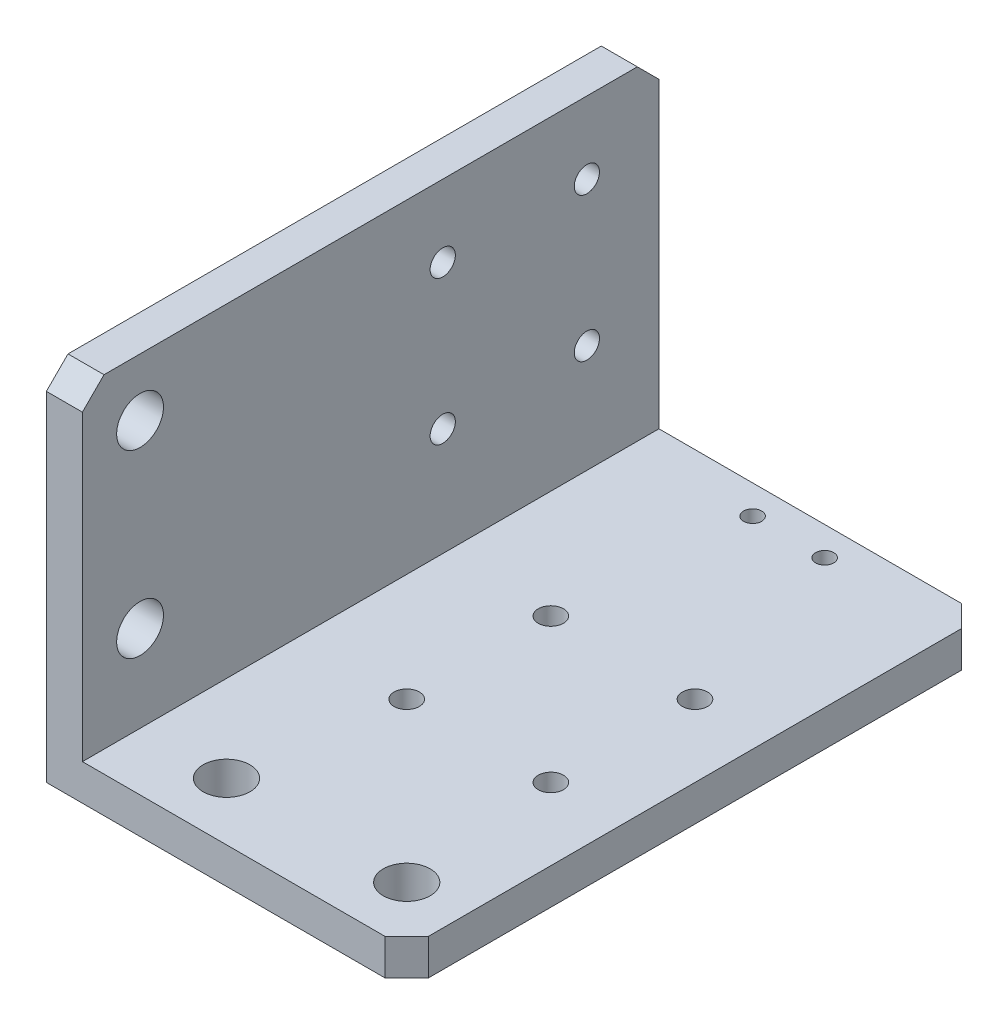
from build123d import *

# Parameters (mm, degrees)
ESTRUSIONE_ESTRUSIONE1_DEPTH = 80
FORO_6_5_6_5_1_D             = 6.5
FORO_6_5_6_5_2_D             = 6.5
FORO_6_5_6_5_2_DEPTH         = 5
FORO_6_5_6_5_2_TIP           = 1.952797012
TAGLIO_ESTRUSIONE3_REACH     = 108.771
SCHIZZO10_R                  = 1.75
TAGLIO_ESTRUSIONE4_REACH     = 108.771
SCHIZZO11_R                  = 1.75
SMUSSO1_SIZE                 = 3
TAGLIO_ESTRUSIONE5_REACH     = 106.523
SCHIZZO12_R                  = 1.25


with BuildPart() as part:
    # Schizzo1 → Estrusione-Estrusione1 (new body)
    with BuildSketch(Plane.XY):
        Polygon((0, 0), (0, 50), (5, 50), (5, 5), (50, 5), (50, 0), align=None)
    extrude(amount=ESTRUSIONE_ESTRUSIONE1_DEPTH)

    # Foro Ø6.5 (6.5)-1 (through all)
    with Locations(Plane(origin=(0, 0, 0), x_dir=(-1, 0, 0), z_dir=(0, -1, 0))):
        with Locations((-17, -72), (-42, -72)):
            Hole(FORO_6_5_6_5_1_D / 2)

    # Foro Ø6.5 (6.5)-2
    with Locations(Plane.ZY):
        with Locations((72, 42), (72, 17)):
            Hole(FORO_6_5_6_5_2_D / 2, depth=FORO_6_5_6_5_2_DEPTH)
            with Locations((0, 0, -(FORO_6_5_6_5_2_DEPTH + FORO_6_5_6_5_2_TIP / 2))):  # 118° drill point
                Cone(0, FORO_6_5_6_5_2_D / 2, FORO_6_5_6_5_2_TIP, mode=Mode.SUBTRACT)

    # Schizzo10 → Taglio-Estrusione3 (cut, up to next)
    with BuildSketch(Plane.ZY, mode=Mode.PRIVATE) as taglio_estrusione3_sk1:
        with Locations((10, 40)):
            Circle(SCHIZZO10_R)
    taglio_estrusione3_tool1 = extrude(taglio_estrusione3_sk1.sketch, amount=-TAGLIO_ESTRUSIONE3_REACH, mode=Mode.PRIVATE) & part.part
    # Schizzo10 → Taglio-Estrusione3 (cut, up to next)
    with BuildSketch(Plane.ZY, mode=Mode.PRIVATE) as taglio_estrusione3_sk2:
        with Locations((30, 40)):
            Circle(SCHIZZO10_R)
    taglio_estrusione3_tool2 = extrude(taglio_estrusione3_sk2.sketch, amount=-TAGLIO_ESTRUSIONE3_REACH, mode=Mode.PRIVATE) & part.part
    # Schizzo10 → Taglio-Estrusione3 (cut, up to next)
    with BuildSketch(Plane.ZY, mode=Mode.PRIVATE) as taglio_estrusione3_sk3:
        with Locations((30, 20)):
            Circle(SCHIZZO10_R)
    taglio_estrusione3_tool3 = extrude(taglio_estrusione3_sk3.sketch, amount=-TAGLIO_ESTRUSIONE3_REACH, mode=Mode.PRIVATE) & part.part
    # Schizzo10 → Taglio-Estrusione3 (cut, up to next)
    with BuildSketch(Plane.ZY, mode=Mode.PRIVATE) as taglio_estrusione3_sk4:
        with Locations((10, 20)):
            Circle(SCHIZZO10_R)
    taglio_estrusione3_tool4 = extrude(taglio_estrusione3_sk4.sketch, amount=-TAGLIO_ESTRUSIONE3_REACH, mode=Mode.PRIVATE) & part.part
    add(taglio_estrusione3_tool1.solids().sort_by_distance((0, 40, 10))[0], mode=Mode.SUBTRACT)
    add(taglio_estrusione3_tool2.solids().sort_by_distance((0, 40, 30))[0], mode=Mode.SUBTRACT)
    add(taglio_estrusione3_tool3.solids().sort_by_distance((0, 20, 30))[0], mode=Mode.SUBTRACT)
    add(taglio_estrusione3_tool4.solids().sort_by_distance((0, 20, 10))[0], mode=Mode.SUBTRACT)

    # Schizzo11 → Taglio-Estrusione4 (cut, up to next)
    with BuildSketch(Plane.XZ, mode=Mode.PRIVATE) as taglio_estrusione4_sk1:
        with Locations((20, 30)):
            Circle(SCHIZZO11_R)
    taglio_estrusione4_tool1 = extrude(taglio_estrusione4_sk1.sketch, amount=-TAGLIO_ESTRUSIONE4_REACH, mode=Mode.PRIVATE) & part.part
    # Schizzo11 → Taglio-Estrusione4 (cut, up to next)
    with BuildSketch(Plane.XZ, mode=Mode.PRIVATE) as taglio_estrusione4_sk2:
        with Locations((20, 50)):
            Circle(SCHIZZO11_R)
    taglio_estrusione4_tool2 = extrude(taglio_estrusione4_sk2.sketch, amount=-TAGLIO_ESTRUSIONE4_REACH, mode=Mode.PRIVATE) & part.part
    # Schizzo11 → Taglio-Estrusione4 (cut, up to next)
    with BuildSketch(Plane.XZ, mode=Mode.PRIVATE) as taglio_estrusione4_sk3:
        with Locations((40, 50)):
            Circle(SCHIZZO11_R)
    taglio_estrusione4_tool3 = extrude(taglio_estrusione4_sk3.sketch, amount=-TAGLIO_ESTRUSIONE4_REACH, mode=Mode.PRIVATE) & part.part
    # Schizzo11 → Taglio-Estrusione4 (cut, up to next)
    with BuildSketch(Plane.XZ, mode=Mode.PRIVATE) as taglio_estrusione4_sk4:
        with Locations((40, 30)):
            Circle(SCHIZZO11_R)
    taglio_estrusione4_tool4 = extrude(taglio_estrusione4_sk4.sketch, amount=-TAGLIO_ESTRUSIONE4_REACH, mode=Mode.PRIVATE) & part.part
    add(taglio_estrusione4_tool1.solids().sort_by_distance((20, 0, 30))[0], mode=Mode.SUBTRACT)
    add(taglio_estrusione4_tool2.solids().sort_by_distance((20, 0, 50))[0], mode=Mode.SUBTRACT)
    add(taglio_estrusione4_tool3.solids().sort_by_distance((40, 0, 50))[0], mode=Mode.SUBTRACT)
    add(taglio_estrusione4_tool4.solids().sort_by_distance((40, 0, 30))[0], mode=Mode.SUBTRACT)

    # Smusso1
    smusso1_edges = [part.edges().sort_by_distance(p)[0] for p in [
        (2.5, 50, 0),
        (50, 2.5, 0),
        (2.5, 50, 80),
        (50, 2.5, 80),
    ]]
    chamfer(smusso1_edges, length=SMUSSO1_SIZE)

    # Schizzo12 → Taglio-Estrusione5 (cut, up to next)
    with BuildSketch(Plane(origin=(0, 5, 0), x_dir=(1, 0, 0), z_dir=(0, 1, 0)), mode=Mode.PRIVATE) as taglio_estrusione5_sk1:
        with Locations((32, -4)):
            Circle(SCHIZZO12_R)
    taglio_estrusione5_tool1 = extrude(taglio_estrusione5_sk1.sketch, amount=-TAGLIO_ESTRUSIONE5_REACH, mode=Mode.PRIVATE) & part.part
    # Schizzo12 → Taglio-Estrusione5 (cut, up to next)
    with BuildSketch(Plane(origin=(0, 5, 0), x_dir=(1, 0, 0), z_dir=(0, 1, 0)), mode=Mode.PRIVATE) as taglio_estrusione5_sk2:
        with Locations((22, -4)):
            Circle(SCHIZZO12_R)
    taglio_estrusione5_tool2 = extrude(taglio_estrusione5_sk2.sketch, amount=-TAGLIO_ESTRUSIONE5_REACH, mode=Mode.PRIVATE) & part.part
    add(taglio_estrusione5_tool1.solids().sort_by_distance((32, 5, 4))[0], mode=Mode.SUBTRACT)
    add(taglio_estrusione5_tool2.solids().sort_by_distance((22, 5, 4))[0], mode=Mode.SUBTRACT)


solid = part.part
